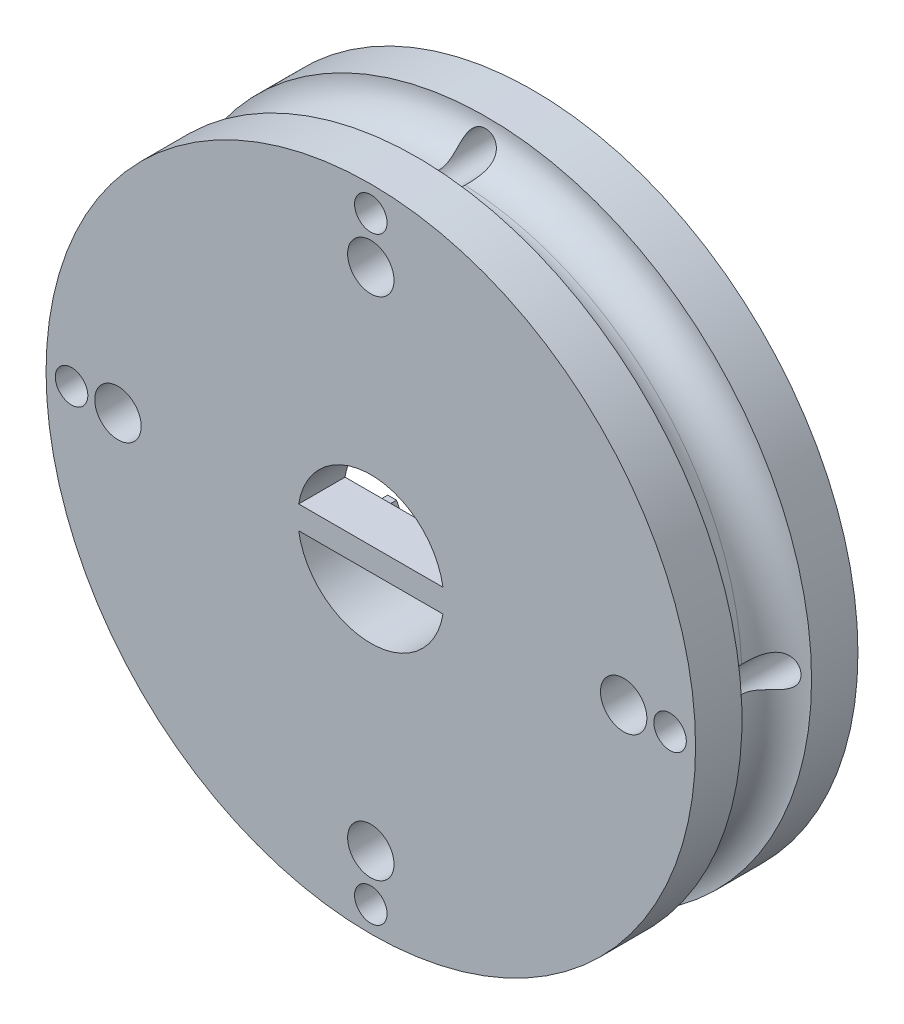
from build123d import *

# Parameters (mm, degrees)
SKETCH1_R               = 14
BOSS_EXTRUDE1_DEPTH     = 7
SKETCH3_R               = 3.15
CUT_EXTRUDE1_DEPTH      = 22
SKETCH4_W               = 7
SKETCH4_H               = 1
BOSS_EXTRUDE2_DEPTH     = 2
SKETCH5_R               = 12
SKETCH5_R_2             = 3.5
CUT_EXTRUDE2_DEPTH      = 5
SKETCH6_W               = 7
SKETCH6_H               = 2.5
CUT_EXTRUDE3_DEPTH      = 5
SKETCH7_R               = 14
SKETCH7_R_2             = 12.5
CUT_EXTRUDE4_DEPTH      = 5
SKETCH8_R               = 14
SKETCH8_R_2             = 12.5
BOSS_EXTRUDE3_DEPTH     = 2
FILLET1_R               = 1.5
CUT_EXTRUDE7_DEPTH      = 22
CUT_EXTRUDE7_DEPTH_BACK = 22
SKETCH9_R               = 1
SKETCH9_R_2             = 0.7
SKETCH10_W              = 6.874413596
SKETCH10_H              = 7.54594332
CUT_EXTRUDE8_DEPTH      = 3


with BuildPart() as part:
    # Sketch1 → Boss-Extrude1 (new body)
    with BuildSketch(Plane.XY):
        Circle(SKETCH1_R)
    extrude(amount=BOSS_EXTRUDE1_DEPTH)

    # Sketch3 → Cut-Extrude1 (cut, through all)
    with BuildSketch(Plane(origin=(0, 0, 0), x_dir=(-1, 0, 0), z_dir=(0, 0, -1))):
        Circle(SKETCH3_R)
    extrude(amount=-CUT_EXTRUDE1_DEPTH, mode=Mode.SUBTRACT)

    # Sketch4 → Boss-Extrude2 (add)
    with BuildSketch(Plane.XY.offset(7)):
        Rectangle(SKETCH4_W, SKETCH4_H)
    extrude(amount=-BOSS_EXTRUDE2_DEPTH)

    # Sketch5 → Cut-Extrude2 (cut)
    with BuildSketch(Plane(origin=(0, 0, 0), x_dir=(-1, 0, 0), z_dir=(0, 0, -1))):
        Circle(SKETCH5_R)
        Circle(SKETCH5_R_2, mode=Mode.SUBTRACT)
    extrude(amount=-CUT_EXTRUDE2_DEPTH, mode=Mode.SUBTRACT)

    # Sketch6 → Cut-Extrude3 (cut)
    with BuildSketch(Plane(origin=(0, 0, 0), x_dir=(-1, 0, 0), z_dir=(0, 0, -1))):
        Rectangle(SKETCH6_W, SKETCH6_H)
    extrude(amount=-CUT_EXTRUDE3_DEPTH, mode=Mode.SUBTRACT)

    # Sketch7 → Cut-Extrude4 (cut)
    with BuildSketch(Plane(origin=(0, 0, 0), x_dir=(-1, 0, 0), z_dir=(0, 0, -1))):
        Circle(SKETCH7_R)
        Circle(SKETCH7_R_2, mode=Mode.SUBTRACT)
    extrude(amount=-CUT_EXTRUDE4_DEPTH, mode=Mode.SUBTRACT)

    # Sketch8 → Boss-Extrude3 (add)
    with BuildSketch(Plane.XY):
        with Locations(Location((0, 0, 0), (0, 0, 180))):
            Circle(SKETCH8_R)
        with Locations(Location((0, 0, 0), (0, 0, 180))):
            Circle(SKETCH8_R_2, mode=Mode.SUBTRACT)
    extrude(amount=BOSS_EXTRUDE3_DEPTH)

    # Fillet1
    fillet1_edges = [part.edges().sort_by_distance(p)[0] for p in [
        (12.5, 0, 5),
        (12.5, 0, 2),
    ]]
    fillet(fillet1_edges, radius=FILLET1_R - 0.0001)  # a hair under: the kernel refuses the full size

    # Sketch9 → Cut-Extrude7 (cut, two sides: drawn at the far end of the back side and taken through both)
    with BuildSketch(Plane(origin=(0, 0, 0), x_dir=(-1, 0, 0), z_dir=(0, 0, -1)).offset(-CUT_EXTRUDE7_DEPTH_BACK)):
        with Locations((0, 10.9)):
            Circle(SKETCH9_R)
        with Locations((0, 12.9)):
            Circle(SKETCH9_R_2)
        with Locations((12.9, 0)):
            Circle(SKETCH9_R_2)
        with Locations((0, -12.9)):
            Circle(SKETCH9_R_2)
        with Locations((-12.9, 0)):
            Circle(SKETCH9_R_2)
        with Locations((-10.9, 0)):
            Circle(SKETCH9_R)
        with Locations((10.9, 0)):
            Circle(SKETCH9_R)
        with Locations((0, -10.9)):
            Circle(SKETCH9_R)
    extrude(amount=CUT_EXTRUDE7_DEPTH + CUT_EXTRUDE7_DEPTH_BACK, mode=Mode.SUBTRACT)

    # Sketch10 → Cut-Extrude8 (cut)
    with BuildSketch(Plane(origin=(0, 0, 0), x_dir=(-1, 0, 0), z_dir=(0, 0, -1))):
        with Locations((0.008465514, -0.14973146)):
            Rectangle(SKETCH10_W, SKETCH10_H)
    extrude(amount=-CUT_EXTRUDE8_DEPTH, mode=Mode.SUBTRACT)


solid = part.part
